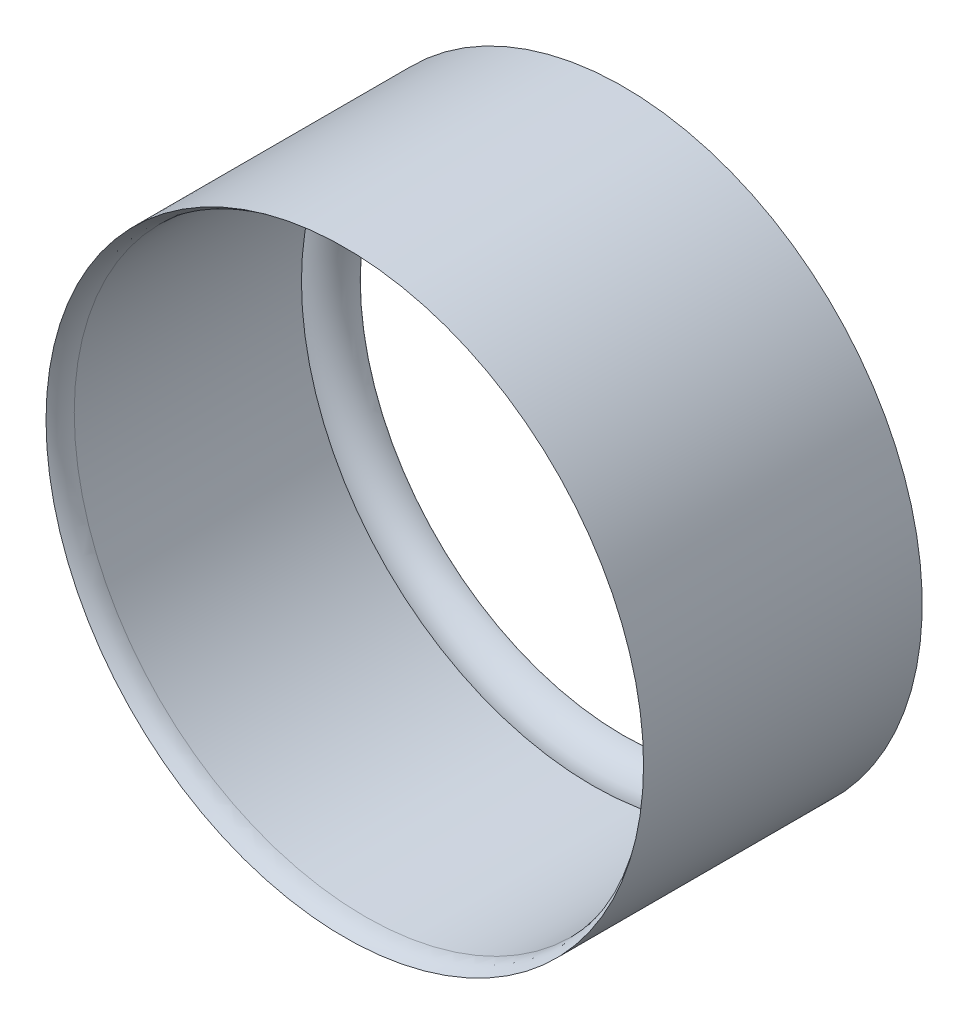
from build123d import *

# Parameters (mm, degrees)
CROQUIS1_R              = 482.5
CROQUIS1_R_2            = 470
SALIENTE_EXTRUIR1_DEPTH = 400
REDONDEO1_R             = 50
SALIENTE_EXTRUIR2_START = 50
CROQUIS2_R              = 482.5
CROQUIS2_R_2            = 425
SALIENTE_EXTRUIR2_DEPTH = 50
REDONDEO3_R             = 50


with BuildPart() as part:
    # Croquis1 → Saliente-Extruir1 (new body)
    with BuildSketch(Plane(origin=(0, 0, 0), x_dir=(0, 1, 0), z_dir=(0, 0, 1))):
        with Locations(Location((0, 0, 0), (0, 0, 270))):
            Circle(CROQUIS1_R)
        with Locations(Location((0, 0, 0), (0, 0, 270))):
            Circle(CROQUIS1_R_2, mode=Mode.SUBTRACT)
    extrude(amount=SALIENTE_EXTRUIR1_DEPTH)

    # Redondeo1
    # the kernel refuses this fillet: 50 mm, written as the material it takes off along each edge
    with BuildSketch(Plane(origin=(0, 0, 400), x_dir=(1, 0, 0), z_dir=(0, -1, 0))) as redondeo1_piece_1:
        with BuildLine():
            CenterArc((520, -33.071891388), REDONDEO1_R, 138.590377891, 41.409622109)
            Line((482.5, 0), (481.75, 0.661437828))
            ThreePointArc((481.75, 0.661437828), (476.25, 1), (470, 1))
            Line((470, 1), (469, 0))
            Line((469, 0), (469, -33.071891388))
            Line((469, -33.071891388), (470, -33.071891388))
        make_face()
    revolve(axis=Axis((0, 0, 400), (0, 0, 1)), mode=Mode.SUBTRACT)

    # Croquis2 → Saliente-Extruir2 (add)
    with BuildSketch(Plane(origin=(0, 0, 0), x_dir=(1, 0, 0), z_dir=(0, 0, -1)).offset(SALIENTE_EXTRUIR2_START)):
        with Locations(Location((0, 0, 0), (0, 0, 180))):
            Circle(CROQUIS2_R)
        with Locations(Location((0, 0, 0), (0, 0, 180))):
            Circle(CROQUIS2_R_2, mode=Mode.SUBTRACT)
    extrude(amount=-SALIENTE_EXTRUIR2_DEPTH)

    # Redondeo3
    # the kernel refuses this fillet: 50 mm, written as the material it takes off along each edge
    with BuildSketch(Plane(origin=(0, 0, 0), x_dir=(-1, 0, 0), z_dir=(0, -1, 0))) as redondeo3_piece_1:
        with BuildLine():
            CenterArc((475, 49.749371855), REDONDEO3_R, 180, 84.260829523)
            Line((470, 0), (469.9, -0.994987437))
            ThreePointArc((469.9, -0.994987437), (447.5, -1), (425, -1))
            Line((425, -1), (424, 0))
            Line((424, 0), (424, 49.749371855))
            Line((424, 49.749371855), (425, 49.749371855))
        make_face()
    revolve(axis=Axis((0, 0, 0), (0, 0, -1)), mode=Mode.SUBTRACT)


solid = part.part
